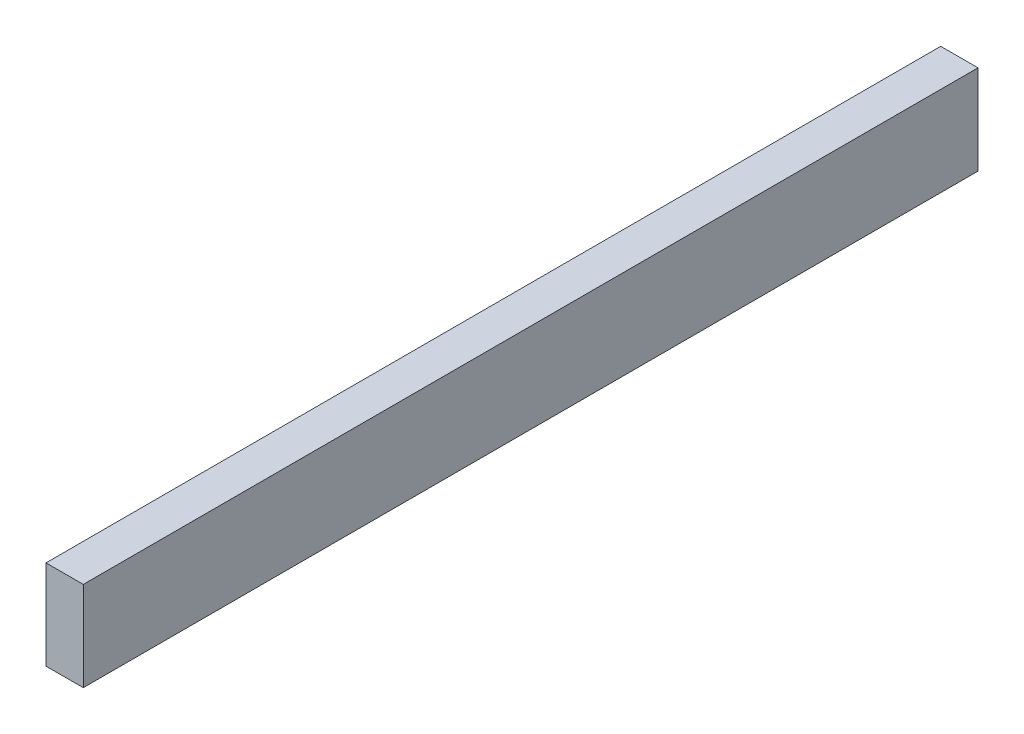
from build123d import *

# Parameters (mm, degrees)
SKIZZE1_W                       = 120
SKIZZE1_H                       = 12
AUFSATZ_LINEAR_AUSTRAGEN1_DEPTH = 5


with BuildPart() as part:
    # Skizze1 → Aufsatz-Linear austragen1 (new body)
    with BuildSketch(Plane(origin=(0, 0, 0), x_dir=(0, 0, -1), z_dir=(1, 0, 0))):
        with Locations((60, 6)):
            Rectangle(SKIZZE1_W, SKIZZE1_H)
    extrude(amount=AUFSATZ_LINEAR_AUSTRAGEN1_DEPTH)


solid = part.part
